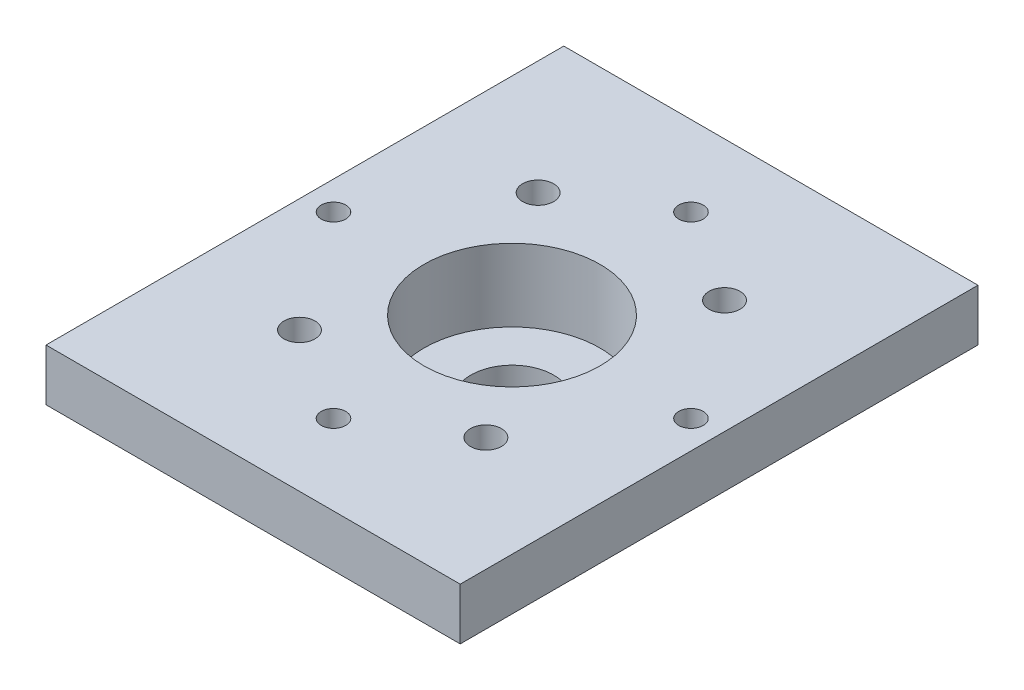
from build123d import *

# Parameters (mm, degrees)
SKETCH1_W           = 45.72
SKETCH1_H           = 58.42
BOSS_EXTRUDE1_DEPTH = 6.35
SKETCH2_R           = 1.905
CUT_EXTRUDE1_DEPTH  = 40.859352933
SKETCH3_W           = 36.744311458
SKETCH3_H           = 46.10356321
BOSS_EXTRUDE2_DEPTH = 5.08
SKETCH4_R           = 7.62
SKETCH4_R_2         = 5.08
BOSS_EXTRUDE3_DEPTH = 12.7
FILLET1_R           = 2.54
SKETCH5_R           = 10.795
CUT_EXTRUDE2_DEPTH  = 8.89
CUT_EXTRUDE4_START  = -19.05
SKETCH4_2_R         = 5.08
CUT_EXTRUDE4_DEPTH  = 19.05
SKETCH6_W           = 50.8
SKETCH6_H           = 63.5
SKETCH6_W_2         = 38.309798332
SKETCH6_H_2         = 47.887247915
BOSS_EXTRUDE4_DEPTH = 6.35
SKETCH7_R           = 1.5
CUT_EXTRUDE5_DEPTH  = 50.233772553


with BuildPart() as part:
    # Sketch1 → Boss-Extrude1 (new body)
    with BuildSketch(Plane(origin=(0, 0, 0), x_dir=(1, 0, 0), z_dir=(0, 1, 0))):
        with Locations((2.874210526, -0.559043062)):
            Rectangle(SKETCH1_W, SKETCH1_H)
    extrude(amount=BOSS_EXTRUDE1_DEPTH)

    # Sketch2 → Cut-Extrude1 (cut, through all)
    with BuildSketch(Plane(origin=(0, 6.35, 0), x_dir=(1, 0, 0), z_dir=(0, 1, 0))):
        with Locations((-8.555789474, 14.045956938)):
            Circle(SKETCH2_R)
        with Locations((14.304210526, 14.045956938)):
            Circle(SKETCH2_R)
        with Locations((-8.612265606, -15.163988465)):
            Circle(SKETCH2_R)
        with Locations((14.247734394, -15.163988465)):
            Circle(SKETCH2_R)
    extrude(amount=-CUT_EXTRUDE1_DEPTH, mode=Mode.SUBTRACT)

    # Sketch3 → Boss-Extrude2 (add)
    with BuildSketch(Plane.XZ):
        with Locations((2.874210526, 0.559043062)):
            Rectangle(SKETCH3_W, SKETCH3_H)
    extrude(amount=BOSS_EXTRUDE2_DEPTH)

    # Sketch4 → Boss-Extrude3 (add)
    with BuildSketch(Plane.XZ.offset(5.08)):
        with Locations((2.874210526, 0.559043062)):
            Circle(SKETCH4_R)
        with Locations((2.874210526, 0.559043062)):
            Circle(SKETCH4_R_2, mode=Mode.SUBTRACT)
    extrude(amount=BOSS_EXTRUDE3_DEPTH)

    # Fillet1
    fillet1_edges = [part.edges().sort_by_distance(p)[0] for p in [
        (25.734210526, 3.175, -28.650956938),
        (-19.985789474, 3.175, -28.650956938),
        (-19.985789474, 3.175, 29.769043062),
        (25.734210526, 3.175, 29.769043062),
    ]]
    fillet(fillet1_edges, radius=FILLET1_R)

    # Sketch5 → Cut-Extrude2 (cut)
    with BuildSketch(Plane(origin=(0, 6.35, 0), x_dir=(1, 0, 0), z_dir=(0, 1, 0))):
        with Locations((2.84597246, -0.559015764)):
            Circle(SKETCH5_R)
    extrude(amount=-CUT_EXTRUDE2_DEPTH, mode=Mode.SUBTRACT)

    # Sketch4<2> → Cut-Extrude4 (cut)
    with BuildSketch(Plane.XZ.offset(5.08).offset(CUT_EXTRUDE4_START)):
        with Locations((2.874210526, 0.559043062)):
            Circle(SKETCH4_2_R)
    extrude(amount=CUT_EXTRUDE4_DEPTH, mode=Mode.SUBTRACT)

    # Sketch6 → Boss-Extrude4 (add)
    with BuildSketch(Plane(origin=(0, 6.35, 0), x_dir=(1, 0, 0), z_dir=(0, 1, 0))):
        with Locations((2.84597246, -0.559015764)):
            Rectangle(SKETCH6_W, SKETCH6_H)
        with Locations((2.84597246, -0.559015763)):
            Rectangle(SKETCH6_W_2, SKETCH6_H_2, mode=Mode.SUBTRACT)
    extrude(amount=-BOSS_EXTRUDE4_DEPTH)

    # Sketch7 → Cut-Extrude5 (cut, through all)
    with BuildSketch(Plane(origin=(0, 6.35, 0), x_dir=(1, 0, 0), z_dir=(0, 1, 0))):
        with Locations((2.874210526, 21.361267155)):
            Circle(SKETCH7_R)
        with Locations((2.874210526, -22.479353279)):
            Circle(SKETCH7_R)
        with Locations((-19.04609969, -0.559043062)):
            Circle(SKETCH7_R)
        with Locations((24.794520743, -0.559043062)):
            Circle(SKETCH7_R)
    extrude(amount=-CUT_EXTRUDE5_DEPTH, mode=Mode.SUBTRACT)


solid = part.part
